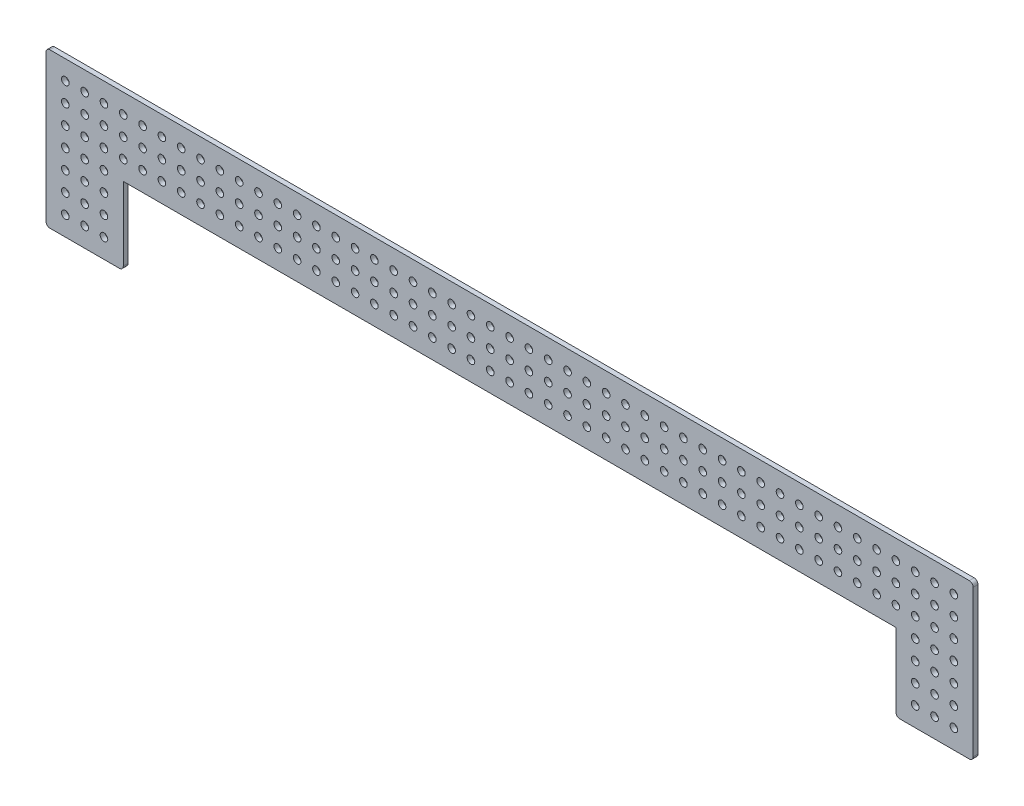
from build123d import *

# Parameters (mm, degrees)
BOSS_EXTRUDE1_DEPTH = 3.175
SKETCH3_R           = 2.505
CUT_EXTRUDE1_DEPTH  = 503.974963512


with BuildPart() as part:
    # Sketch2 → Boss-Extrude1 (new body)
    with BuildSketch(Plane.XY):
        with BuildLine():
            Line((126.386816889, -46.477764478), (-478.133183111, -46.477764478))
            ThreePointArc((-478.133183111, -46.477764478), (-479.929234335, -47.221713254), (-480.673183111, -49.017764478))
            Line((-480.673183111, -49.017764478), (-480.673183111, -145.537764478))
            ThreePointArc((-480.673183111, -145.537764478), (-479.929234335, -147.333815702), (-478.133183111, -148.077764478))
            Line((-478.133183111, -148.077764478), (-432.413183111, -148.077764478))
            ThreePointArc((-432.413183111, -148.077764478), (-430.617131887, -147.333815702), (-429.873183111, -145.537764478))
            Line((-429.873183111, -145.537764478), (-429.873183111, -97.277764478))
            Line((-429.873183111, -97.277764478), (78.126816889, -97.277764478))
            Line((78.126816889, -97.277764478), (78.126816889, -145.537764478))
            ThreePointArc((78.126816889, -145.537764478), (78.870765665, -147.333815702), (80.666816889, -148.077764478))
            Line((80.666816889, -148.077764478), (126.386816889, -148.077764478))
            ThreePointArc((126.386816889, -148.077764478), (128.182868113, -147.333815702), (128.926816889, -145.537764478))
            Line((128.926816889, -145.537764478), (128.926816889, -49.017764478))
            ThreePointArc((128.926816889, -49.017764478), (128.182868113, -47.221713254), (126.386816889, -46.477764478))
        make_face()
    extrude(amount=BOSS_EXTRUDE1_DEPTH)

    # Sketch3 → Cut-Extrude1 (cut, through all)
    with BuildSketch(Plane.XY.offset(3.175)):
        with Locations((-467.973183111, -59.177764478)):
            Circle(SKETCH3_R)
        with Locations((-455.273183111, -59.177764478)):
            Circle(SKETCH3_R)
        with Locations((-442.573183111, -59.177764478)):
            Circle(SKETCH3_R)
        with Locations((-429.873183111, -59.177764478)):
            Circle(SKETCH3_R)
        with Locations((-417.173183111, -59.177764478)):
            Circle(SKETCH3_R)
        with Locations((-404.473183111, -59.177764478)):
            Circle(SKETCH3_R)
        with Locations((-391.773183111, -59.177764478)):
            Circle(SKETCH3_R)
        with Locations((-379.073183111, -59.177764478)):
            Circle(SKETCH3_R)
        with Locations((-366.373183111, -59.177764478)):
            Circle(SKETCH3_R)
        with Locations((-353.673183111, -59.177764478)):
            Circle(SKETCH3_R)
        with Locations((-340.973183111, -59.177764478)):
            Circle(SKETCH3_R)
        with Locations((-328.273183111, -59.177764478)):
            Circle(SKETCH3_R)
        with Locations((-315.573183111, -59.177764478)):
            Circle(SKETCH3_R)
        with Locations((-302.873183111, -59.177764478)):
            Circle(SKETCH3_R)
        with Locations((-290.173183111, -59.177764478)):
            Circle(SKETCH3_R)
        with Locations((-277.473183111, -59.177764478)):
            Circle(SKETCH3_R)
        with Locations((-264.773183111, -59.177764478)):
            Circle(SKETCH3_R)
        with Locations((-252.073183111, -59.177764478)):
            Circle(SKETCH3_R)
        with Locations((-239.373183111, -59.177764478)):
            Circle(SKETCH3_R)
        with Locations((-226.673183111, -59.177764478)):
            Circle(SKETCH3_R)
        with Locations((-213.973183111, -59.177764478)):
            Circle(SKETCH3_R)
        with Locations((-201.273183111, -59.177764478)):
            Circle(SKETCH3_R)
        with Locations((-188.573183111, -59.177764478)):
            Circle(SKETCH3_R)
        with Locations((-175.873183111, -59.177764478)):
            Circle(SKETCH3_R)
        with Locations((-163.173183111, -59.177764478)):
            Circle(SKETCH3_R)
        with Locations((-150.473183111, -59.177764478)):
            Circle(SKETCH3_R)
        with Locations((-137.773183111, -59.177764478)):
            Circle(SKETCH3_R)
        with Locations((-125.073183111, -59.177764478)):
            Circle(SKETCH3_R)
        with Locations((-112.373183111, -59.177764478)):
            Circle(SKETCH3_R)
        with Locations((-99.673183111, -59.177764478)):
            Circle(SKETCH3_R)
        with Locations((-86.973183111, -59.177764478)):
            Circle(SKETCH3_R)
        with Locations((-74.273183111, -59.177764478)):
            Circle(SKETCH3_R)
        with Locations((-61.573183111, -59.177764478)):
            Circle(SKETCH3_R)
        with Locations((-48.873183111, -59.177764478)):
            Circle(SKETCH3_R)
        with Locations((-36.173183111, -59.177764478)):
            Circle(SKETCH3_R)
        with Locations((-23.473183111, -59.177764478)):
            Circle(SKETCH3_R)
        with Locations((-10.773183111, -59.177764478)):
            Circle(SKETCH3_R)
        with Locations((1.926816889, -59.177764478)):
            Circle(SKETCH3_R)
        with Locations((14.626816889, -59.177764478)):
            Circle(SKETCH3_R)
        with Locations((27.326816889, -59.177764478)):
            Circle(SKETCH3_R)
        with Locations((40.026816889, -59.177764478)):
            Circle(SKETCH3_R)
        with Locations((52.726816889, -59.177764478)):
            Circle(SKETCH3_R)
        with Locations((65.426816889, -59.177764478)):
            Circle(SKETCH3_R)
        with Locations((78.126816889, -59.177764478)):
            Circle(SKETCH3_R)
        with Locations((90.826816889, -59.177764478)):
            Circle(SKETCH3_R)
        with Locations((103.526816889, -59.177764478)):
            Circle(SKETCH3_R)
        with Locations((116.226816889, -59.177764478)):
            Circle(SKETCH3_R)
        with Locations((-455.273183111, -71.877764478)):
            Circle(SKETCH3_R)
        with Locations((-442.573183111, -71.877764478)):
            Circle(SKETCH3_R)
        with Locations((-429.873183111, -71.877764478)):
            Circle(SKETCH3_R)
        with Locations((-417.173183111, -71.877764478)):
            Circle(SKETCH3_R)
        with Locations((-404.473183111, -71.877764478)):
            Circle(SKETCH3_R)
        with Locations((-391.773183111, -71.877764478)):
            Circle(SKETCH3_R)
        with Locations((-379.073183111, -71.877764478)):
            Circle(SKETCH3_R)
        with Locations((-366.373183111, -71.877764478)):
            Circle(SKETCH3_R)
        with Locations((-353.673183111, -71.877764478)):
            Circle(SKETCH3_R)
        with Locations((-340.973183111, -71.877764478)):
            Circle(SKETCH3_R)
        with Locations((-328.273183111, -71.877764478)):
            Circle(SKETCH3_R)
        with Locations((-315.573183111, -71.877764478)):
            Circle(SKETCH3_R)
        with Locations((-302.873183111, -71.877764478)):
            Circle(SKETCH3_R)
        with Locations((-290.173183111, -71.877764478)):
            Circle(SKETCH3_R)
        with Locations((-277.473183111, -71.877764478)):
            Circle(SKETCH3_R)
        with Locations((-264.773183111, -71.877764478)):
            Circle(SKETCH3_R)
        with Locations((-252.073183111, -71.877764478)):
            Circle(SKETCH3_R)
        with Locations((-239.373183111, -71.877764478)):
            Circle(SKETCH3_R)
        with Locations((-226.673183111, -71.877764478)):
            Circle(SKETCH3_R)
        with Locations((-213.973183111, -71.877764478)):
            Circle(SKETCH3_R)
        with Locations((-201.273183111, -71.877764478)):
            Circle(SKETCH3_R)
        with Locations((-188.573183111, -71.877764478)):
            Circle(SKETCH3_R)
        with Locations((-175.873183111, -71.877764478)):
            Circle(SKETCH3_R)
        with Locations((-163.173183111, -71.877764478)):
            Circle(SKETCH3_R)
        with Locations((-150.473183111, -71.877764478)):
            Circle(SKETCH3_R)
        with Locations((-137.773183111, -71.877764478)):
            Circle(SKETCH3_R)
        with Locations((-125.073183111, -71.877764478)):
            Circle(SKETCH3_R)
        with Locations((-112.373183111, -71.877764478)):
            Circle(SKETCH3_R)
        with Locations((-99.673183111, -71.877764478)):
            Circle(SKETCH3_R)
        with Locations((-86.973183111, -71.877764478)):
            Circle(SKETCH3_R)
        with Locations((-74.273183111, -71.877764478)):
            Circle(SKETCH3_R)
        with Locations((-61.573183111, -71.877764478)):
            Circle(SKETCH3_R)
        with Locations((-48.873183111, -71.877764478)):
            Circle(SKETCH3_R)
        with Locations((-36.173183111, -71.877764478)):
            Circle(SKETCH3_R)
        with Locations((-23.473183111, -71.877764478)):
            Circle(SKETCH3_R)
        with Locations((-10.773183111, -71.877764478)):
            Circle(SKETCH3_R)
        with Locations((1.926816889, -71.877764478)):
            Circle(SKETCH3_R)
        with Locations((14.626816889, -71.877764478)):
            Circle(SKETCH3_R)
        with Locations((27.326816889, -71.877764478)):
            Circle(SKETCH3_R)
        with Locations((40.026816889, -71.877764478)):
            Circle(SKETCH3_R)
        with Locations((52.726816889, -71.877764478)):
            Circle(SKETCH3_R)
        with Locations((65.426816889, -71.877764478)):
            Circle(SKETCH3_R)
        with Locations((78.126816889, -71.877764478)):
            Circle(SKETCH3_R)
        with Locations((90.826816889, -71.877764478)):
            Circle(SKETCH3_R)
        with Locations((103.526816889, -71.877764478)):
            Circle(SKETCH3_R)
        with Locations((116.226816889, -71.877764478)):
            Circle(SKETCH3_R)
        with Locations((-455.273183111, -84.577764478)):
            Circle(SKETCH3_R)
        with Locations((-442.573183111, -84.577764478)):
            Circle(SKETCH3_R)
        with Locations((-429.873183111, -84.577764478)):
            Circle(SKETCH3_R)
        with Locations((-417.173183111, -84.577764478)):
            Circle(SKETCH3_R)
        with Locations((-404.473183111, -84.577764478)):
            Circle(SKETCH3_R)
        with Locations((-391.773183111, -84.577764478)):
            Circle(SKETCH3_R)
        with Locations((-379.073183111, -84.577764478)):
            Circle(SKETCH3_R)
        with Locations((-366.373183111, -84.577764478)):
            Circle(SKETCH3_R)
        with Locations((-353.673183111, -84.577764478)):
            Circle(SKETCH3_R)
        with Locations((-340.973183111, -84.577764478)):
            Circle(SKETCH3_R)
        with Locations((-328.273183111, -84.577764478)):
            Circle(SKETCH3_R)
        with Locations((-315.573183111, -84.577764478)):
            Circle(SKETCH3_R)
        with Locations((-302.873183111, -84.577764478)):
            Circle(SKETCH3_R)
        with Locations((-290.173183111, -84.577764478)):
            Circle(SKETCH3_R)
        with Locations((-277.473183111, -84.577764478)):
            Circle(SKETCH3_R)
        with Locations((-264.773183111, -84.577764478)):
            Circle(SKETCH3_R)
        with Locations((-252.073183111, -84.577764478)):
            Circle(SKETCH3_R)
        with Locations((-239.373183111, -84.577764478)):
            Circle(SKETCH3_R)
        with Locations((-226.673183111, -84.577764478)):
            Circle(SKETCH3_R)
        with Locations((-213.973183111, -84.577764478)):
            Circle(SKETCH3_R)
        with Locations((-201.273183111, -84.577764478)):
            Circle(SKETCH3_R)
        with Locations((-188.573183111, -84.577764478)):
            Circle(SKETCH3_R)
        with Locations((-175.873183111, -84.577764478)):
            Circle(SKETCH3_R)
        with Locations((-163.173183111, -84.577764478)):
            Circle(SKETCH3_R)
        with Locations((-150.473183111, -84.577764478)):
            Circle(SKETCH3_R)
        with Locations((-137.773183111, -84.577764478)):
            Circle(SKETCH3_R)
        with Locations((-125.073183111, -84.577764478)):
            Circle(SKETCH3_R)
        with Locations((-112.373183111, -84.577764478)):
            Circle(SKETCH3_R)
        with Locations((-99.673183111, -84.577764478)):
            Circle(SKETCH3_R)
        with Locations((-86.973183111, -84.577764478)):
            Circle(SKETCH3_R)
        with Locations((-74.273183111, -84.577764478)):
            Circle(SKETCH3_R)
        with Locations((-61.573183111, -84.577764478)):
            Circle(SKETCH3_R)
        with Locations((-48.873183111, -84.577764478)):
            Circle(SKETCH3_R)
        with Locations((-36.173183111, -84.577764478)):
            Circle(SKETCH3_R)
        with Locations((-23.473183111, -84.577764478)):
            Circle(SKETCH3_R)
        with Locations((-10.773183111, -84.577764478)):
            Circle(SKETCH3_R)
        with Locations((1.926816889, -84.577764478)):
            Circle(SKETCH3_R)
        with Locations((14.626816889, -84.577764478)):
            Circle(SKETCH3_R)
        with Locations((27.326816889, -84.577764478)):
            Circle(SKETCH3_R)
        with Locations((40.026816889, -84.577764478)):
            Circle(SKETCH3_R)
        with Locations((52.726816889, -84.577764478)):
            Circle(SKETCH3_R)
        with Locations((65.426816889, -84.577764478)):
            Circle(SKETCH3_R)
        with Locations((78.126816889, -84.577764478)):
            Circle(SKETCH3_R)
        with Locations((90.826816889, -84.577764478)):
            Circle(SKETCH3_R)
        with Locations((103.526816889, -84.577764478)):
            Circle(SKETCH3_R)
        with Locations((116.226816889, -84.577764478)):
            Circle(SKETCH3_R)
        with Locations((-467.973183111, -71.877764478)):
            Circle(SKETCH3_R)
        with Locations((-467.973183111, -84.577764478)):
            Circle(SKETCH3_R)
        with Locations((-467.973183111, -135.377764478)):
            Circle(SKETCH3_R)
        with Locations((-455.273183111, -135.377764478)):
            Circle(SKETCH3_R)
        with Locations((-442.573183111, -135.377764478)):
            Circle(SKETCH3_R)
        with Locations((-455.273183111, -122.677764478)):
            Circle(SKETCH3_R)
        with Locations((-442.573183111, -122.677764478)):
            Circle(SKETCH3_R)
        with Locations((-455.273183111, -109.977764478)):
            Circle(SKETCH3_R)
        with Locations((-442.573183111, -109.977764478)):
            Circle(SKETCH3_R)
        with Locations((-455.273183111, -97.277764478)):
            Circle(SKETCH3_R)
        with Locations((-442.573183111, -97.277764478)):
            Circle(SKETCH3_R)
        with Locations((-467.973183111, -122.677764478)):
            Circle(SKETCH3_R)
        with Locations((-467.973183111, -109.977764478)):
            Circle(SKETCH3_R)
        with Locations((-467.973183111, -97.277764478)):
            Circle(SKETCH3_R)
        with Locations((90.826816889, -135.377764478)):
            Circle(SKETCH3_R)
        with Locations((103.526816889, -135.377764478)):
            Circle(SKETCH3_R)
        with Locations((116.226816889, -135.377764478)):
            Circle(SKETCH3_R)
        with Locations((103.526816889, -122.677764478)):
            Circle(SKETCH3_R)
        with Locations((116.226816889, -122.677764478)):
            Circle(SKETCH3_R)
        with Locations((103.526816889, -109.977764478)):
            Circle(SKETCH3_R)
        with Locations((116.226816889, -109.977764478)):
            Circle(SKETCH3_R)
        with Locations((103.526816889, -97.277764478)):
            Circle(SKETCH3_R)
        with Locations((116.226816889, -97.277764478)):
            Circle(SKETCH3_R)
        with Locations((90.826816889, -122.677764478)):
            Circle(SKETCH3_R)
        with Locations((90.826816889, -109.977764478)):
            Circle(SKETCH3_R)
        with Locations((90.826816889, -97.277764478)):
            Circle(SKETCH3_R)
    extrude(amount=-CUT_EXTRUDE1_DEPTH, mode=Mode.SUBTRACT)


solid = part.part
